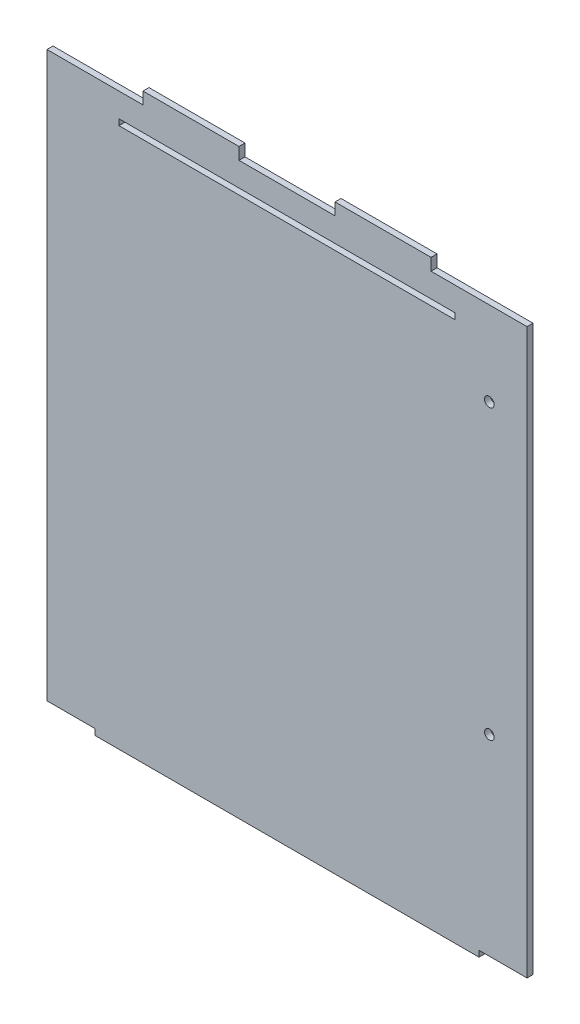
from build123d import *

# Parameters (mm, degrees)
SKETCH1_W           = 177.8
SKETCH1_H           = 3.175
BOSS_EXTRUDE1_DEPTH = 3.175
SKETCH2_R           = 2.54
CUT_EXTRUDE1_DEPTH  = 400.217586349


with BuildPart() as part:
    # Sketch1 → Boss-Extrude1 (new body)
    with BuildSketch(Plane.XY):
        Polygon((0, 301.625), (0, 3.175), (25.4, 3.175), (25.4, 0), (228.6, 0), (228.6, 3.175), (254, 3.175), (254, 301.625), (203.2, 301.625), (203.2, 307.975), (152.4, 307.975), (152.4, 301.625), (101.6, 301.625), (101.6, 307.975), (50.8, 307.975), (50.8, 301.625), align=None)
        with Locations((127, 287.3375)):
            Rectangle(SKETCH1_W, SKETCH1_H, mode=Mode.SUBTRACT)
    extrude(amount=BOSS_EXTRUDE1_DEPTH)

    # Sketch2 → Cut-Extrude1 (cut, through all)
    with BuildSketch(Plane(origin=(0, 0, 0), x_dir=(-1, 0, 0), z_dir=(0, 0, -1))):
        with Locations((-234.063292103, 257.175)):
            Circle(SKETCH2_R)
        with Locations((-234.063292103, 104.775)):
            Circle(SKETCH2_R)
    extrude(amount=-CUT_EXTRUDE1_DEPTH, mode=Mode.SUBTRACT)


solid = part.part
